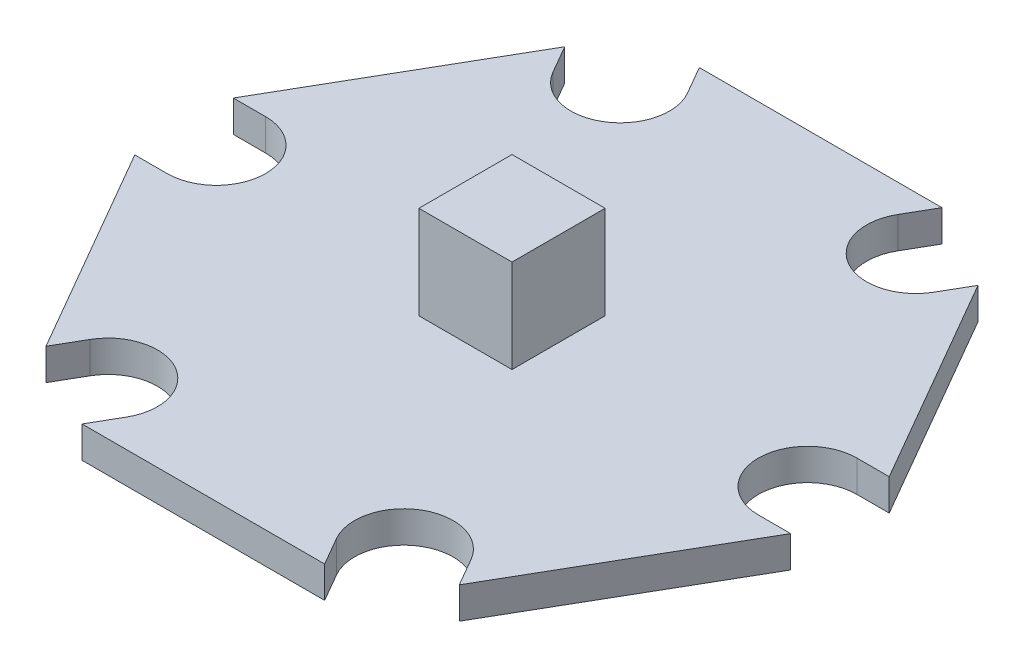
from build123d import *

# Parameters (mm, degrees)
BOSS_EXTRUDE1_DEPTH = 1.016
CUT_EXTRUDE1_DEPTH  = 1.016
CIRPATTERN1_COUNT   = 6
SKETCH3_W           = 3
SKETCH3_H           = 3
BOSS_EXTRUDE2_DEPTH = 3


with BuildPart() as part:
    # Sketch1 → Boss-Extrude1 (new body)
    with BuildSketch(Plane(origin=(0, 0, 0), x_dir=(1, 0, 0), z_dir=(0, 1, 0))):
        Polygon((5.741228812, 9.9441), (-5.741228812, 9.9441), (-11.482457624, 0), (-5.741228812, -9.9441), (5.741228812, -9.9441), (11.482457624, 0), align=None)
    extrude(amount=BOSS_EXTRUDE1_DEPTH)

    # Sketch2 → Cut-Extrude1 (cut)
    with BuildSketch(Plane(origin=(0, 1.016, 0), x_dir=(1, 0, 0), z_dir=(0, 1, 0))):
        with BuildLine():
            Line((9.525, 1.5875), (13.137780832, 1.5875))
            Line((13.137780832, 1.5875), (13.137780832, -1.5875))
            Line((13.137780832, -1.5875), (9.525, -1.5875))
            ThreePointArc((9.525, -1.5875), (7.9375, 0), (9.525, 1.5875))
        make_face()
    cut_extrude1 = extrude(amount=-CUT_EXTRUDE1_DEPTH, mode=Mode.SUBTRACT)

    # CirPattern1: Cut-Extrude1 ×6 about axis
    cirpattern1_axis = Axis((0, 4.2168, 0), (0, -1, 0))
    for i in range(1, CIRPATTERN1_COUNT):
        add(cut_extrude1.rotate(cirpattern1_axis, i * 360 / CIRPATTERN1_COUNT), mode=Mode.SUBTRACT)

    # Sketch3 → Boss-Extrude2 (add)
    with BuildSketch(Plane(origin=(0, 1.016, 0), x_dir=(1, 0, 0), z_dir=(0, 1, 0))):
        Rectangle(SKETCH3_W, SKETCH3_H)
    extrude(amount=BOSS_EXTRUDE2_DEPTH)


solid = part.part
